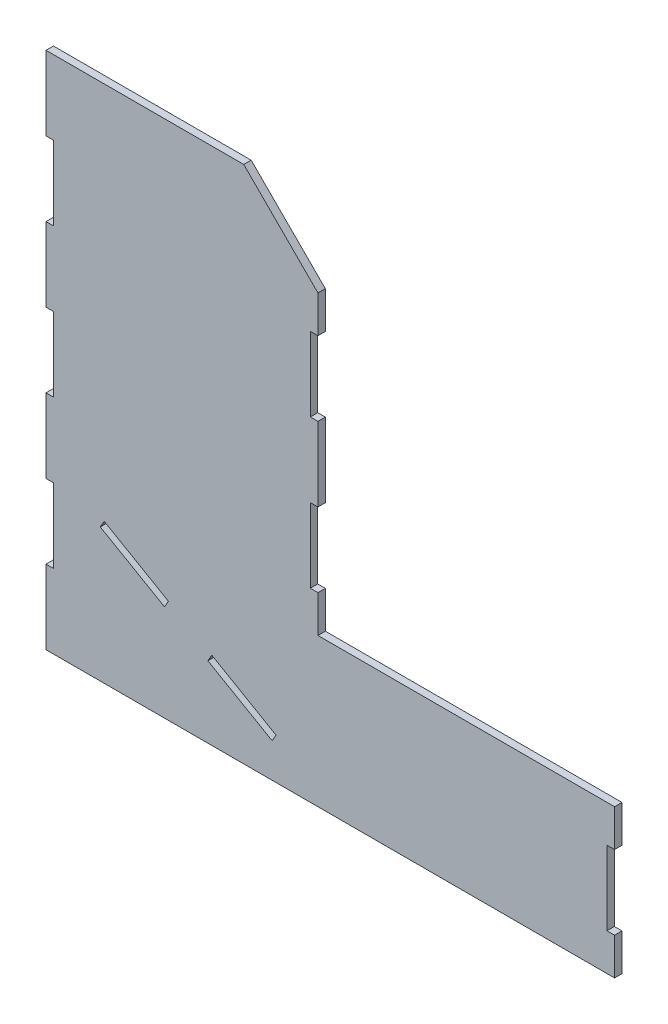
from build123d import *

# Parameters (mm, degrees)
BOSS_EXTRUDE1_DEPTH          = 1.5
CUT_EXTRUDE_THIN1_DEPTH      = 199.424050137
CUT_EXTRUDE_THIN1_DEPTH_BACK = 199.424050137
SKETCH1_3_W                  = 3.18
SKETCH1_3_H                  = 30


with BuildPart() as part:
    # Sketch1 → Boss-Extrude1 (new, symmetric)
    with BuildSketch(Plane.XY):
        Polygon((-13.914893617, 144.397705985), (-93.914893617, 144.397705985), (-93.914893617, -65.602294015), (136.085106383, -65.602294015), (136.085106383, -5.602294015), (16.085106383, -5.602294015), (16.085106383, 114.397705985), align=None)
    extrude(amount=BOSS_EXTRUDE1_DEPTH, both=True)

    # Sketch1<3> → Cut-Extrude-Thin1 (cut, two sides: drawn at the far end of the back side and taken through both)
    with BuildSketch(Plane.XY.offset(-CUT_EXTRUDE_THIN1_DEPTH_BACK)):
        with Locations((-92.414893617, 99.397705985)):
            Rectangle(SKETCH1_3_W, SKETCH1_3_H)
        with Locations((-92.414893617, 39.397705985)):
            Rectangle(SKETCH1_3_W, SKETCH1_3_H)
        with Locations((-92.414893617, -20.602294015)):
            Rectangle(SKETCH1_3_W, SKETCH1_3_H)
        with Locations((14.585106383, 84.397705985)):
            Rectangle(SKETCH1_3_W, SKETCH1_3_H)
        with Locations((14.585106383, 24.397705985)):
            Rectangle(SKETCH1_3_W, SKETCH1_3_H)
        with Locations((134.585106383, -35.602294015)):
            Rectangle(SKETCH1_3_W, SKETCH1_3_H)
        Polygon((-71.9678283, -11.600882329), (-45.987066186, -26.600882329), (-44.397066186, -23.846921545), (-70.3778283, -8.846921545), align=None)
        Polygon((-0.861958934, -48.981927436), (-26.842721048, -33.981927436), (-28.432721048, -36.73588822), (-2.451958934, -51.73588822), align=None)
    extrude(amount=CUT_EXTRUDE_THIN1_DEPTH + CUT_EXTRUDE_THIN1_DEPTH_BACK, mode=Mode.SUBTRACT)


solid = part.part
